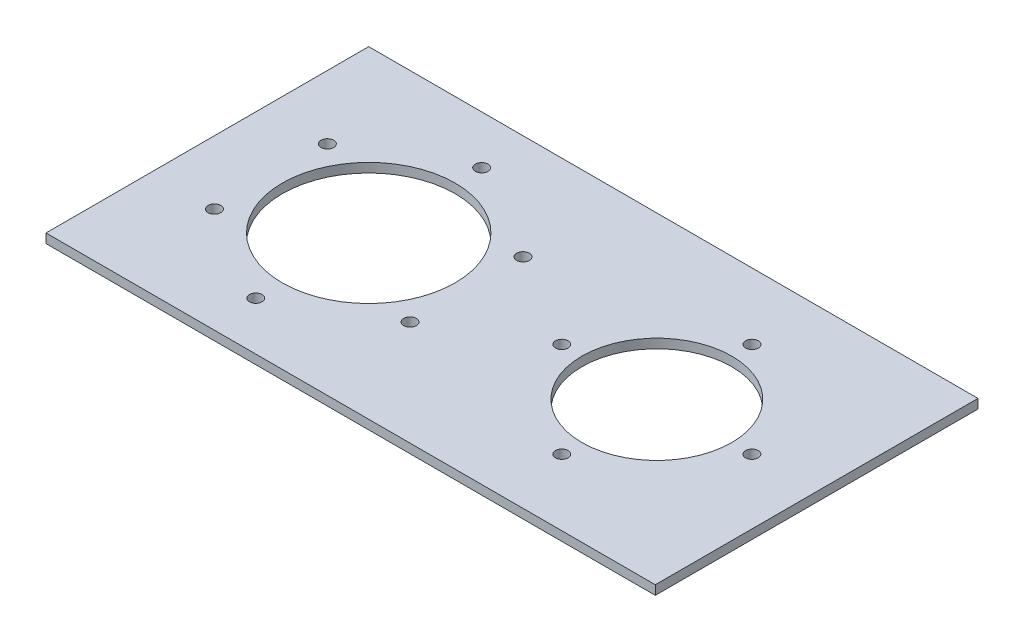
from build123d import *

# Parameters (mm, degrees)
SKETCH1_W           = 528.64321608
SKETCH1_H           = 280
SKETCH1_R           = 75
SKETCH1_R_2         = 5.5
SKETCH1_R_3         = 65
BOSS_EXTRUDE1_DEPTH = 8


with BuildPart() as part:
    # Sketch1 → Boss-Extrude1 (new body)
    with BuildSketch(Plane(origin=(0, 0, 0), x_dir=(1, 0, 0), z_dir=(0, 1, 0))):
        with Locations((124.32160804, 0)):
            Rectangle(SKETCH1_W, SKETCH1_H)
        Circle(SKETCH1_R, mode=Mode.SUBTRACT)
        with Locations((0, -98)):
            Circle(SKETCH1_R_2, mode=Mode.SUBTRACT)
        with Locations((-84.870489571, -49)):
            Circle(SKETCH1_R_2, mode=Mode.SUBTRACT)
        with Locations((-84.870489571, 49)):
            Circle(SKETCH1_R_2, mode=Mode.SUBTRACT)
        with Locations((0, 98)):
            Circle(SKETCH1_R_2, mode=Mode.SUBTRACT)
        with Locations((84.870489571, 49)):
            Circle(SKETCH1_R_2, mode=Mode.SUBTRACT)
        with Locations((84.870489571, -49)):
            Circle(SKETCH1_R_2, mode=Mode.SUBTRACT)
        with Locations((250, 0)):
            Circle(SKETCH1_R_3, mode=Mode.SUBTRACT)
        with Locations((332.5, 0)):
            Circle(SKETCH1_R_2, mode=Mode.SUBTRACT)
        with Locations((250, -82.5)):
            Circle(SKETCH1_R_2, mode=Mode.SUBTRACT)
        with Locations((167.5, 0)):
            Circle(SKETCH1_R_2, mode=Mode.SUBTRACT)
        with Locations((250, 82.5)):
            Circle(SKETCH1_R_2, mode=Mode.SUBTRACT)
    extrude(amount=BOSS_EXTRUDE1_DEPTH)


solid = part.part
